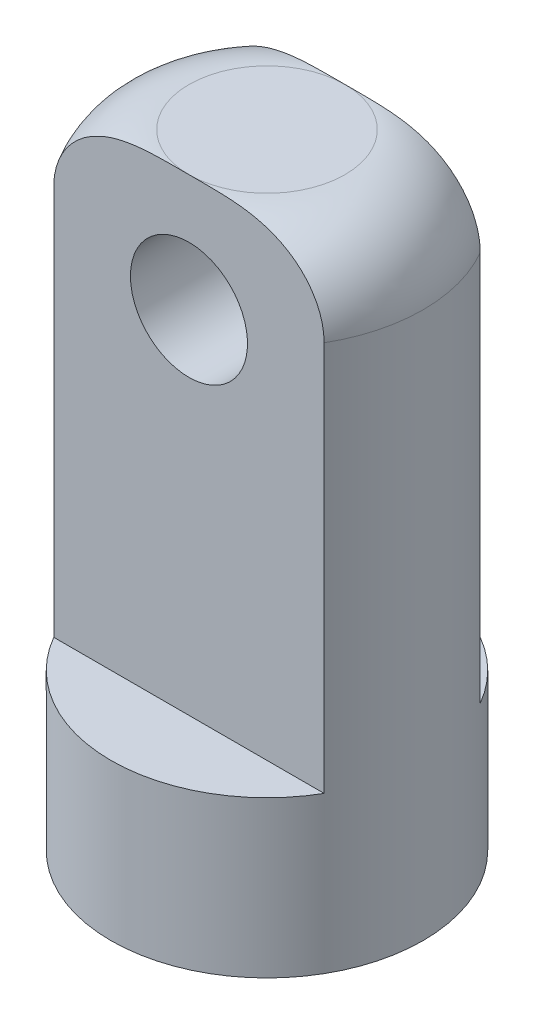
from build123d import *

# Parameters (mm, degrees)
SKETCH1_R               = 20
BOSS_EXTRUDE1_DEPTH     = 80
SKETCH2_W               = 20
SKETCH2_H               = 120
CUT_EXTRUDE1_DEPTH      = 85.852813742
FILLET1_R               = 10
CUT_EXTRUDE2_DEPTH      = 85.85281386
CUT_EXTRUDE2_DEPTH_BACK = 85.85281386
SKETCH3_R               = 7.5


with BuildPart() as part:
    # Sketch1 → Boss-Extrude1 (new body)
    with BuildSketch(Plane(origin=(0, 0, 0), x_dir=(1, 0, 0), z_dir=(0, 1, 0))):
        with Locations(Location((0, 0, 0), (0, 0, 270))):
            Circle(SKETCH1_R)
    extrude(amount=BOSS_EXTRUDE1_DEPTH)

    # Sketch2 → Cut-Extrude1 (cut, symmetric)
    with BuildSketch(Plane(origin=(0, 0, 0), x_dir=(0, 0, -1), z_dir=(1, 0, 0))):
        with Locations((-20, 80)):
            Rectangle(SKETCH2_W, SKETCH2_H)
    cut_extrude1 = extrude(amount=CUT_EXTRUDE1_DEPTH, both=True, mode=Mode.SUBTRACT)

    # Mirror1: Cut-Extrude1 across plane
    add(cut_extrude1.mirror(Plane.XY), mode=Mode.SUBTRACT)

    # Fillet1
    fillet1_edges = [part.edges().sort_by_distance(p)[0] for p in [
        (20, 80, 0),
        (-20, 80, 0),
    ]]
    fillet(fillet1_edges, radius=FILLET1_R - 0.0001)  # a hair under: the kernel refuses the full size

    # Sketch3 → Cut-Extrude2 (cut, two sides: drawn at the far end of the back side and taken through both)
    with BuildSketch(Plane.XY.offset(-CUT_EXTRUDE2_DEPTH_BACK)):
        with Locations(Location((0, 65, 0), (0, 0, 180))):
            Circle(SKETCH3_R)
    extrude(amount=CUT_EXTRUDE2_DEPTH + CUT_EXTRUDE2_DEPTH_BACK, mode=Mode.SUBTRACT)


solid = part.part
